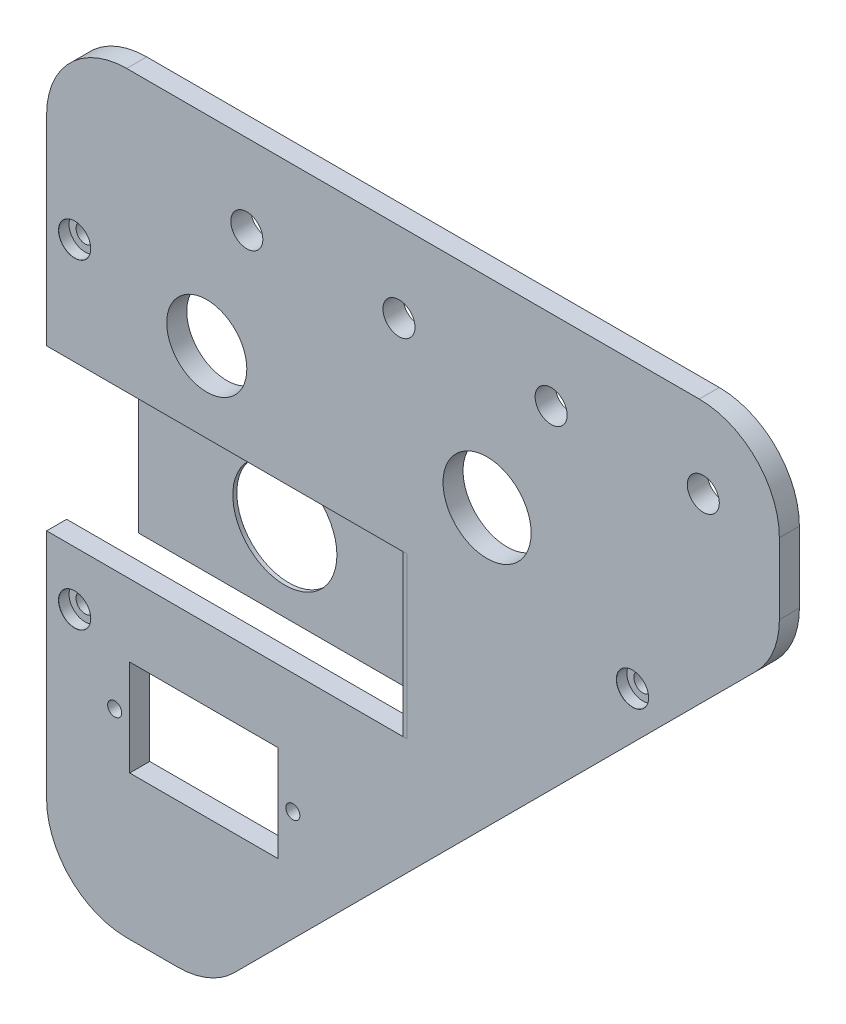
from build123d import *

# Parameters (mm, degrees)
ESTRUSIONE_ESTRUSIONE1_DEPTH                 = 5
FORO_LAMATO_PER_VITE_M4_A_TESTA_CILI_2_COUNT = 2
FORO_LAMATO_PER_VITE_M4_A_TESTA_CILI_2_PITCH = 80
FORO_LAMATO_PER_VITE_M4_A_TESTA_CILI_3_COUNT = 2
FORO_LAMATO_PER_VITE_M4_A_TESTA_CILI_3_PITCH = 141.997761326
TAGLIO_ESTRUSIONE1_DEPTH                     = 263.408079144
TAGLIO_ESTRUSIONE1_DEPTH_BACK                = 263.408079144
SCHIZZO5_R                                   = 1.75
SCHIZZO5_R_2                                 = 10
SCHIZZO5_R_3                                 = 11
SCHIZZO5_R_4                                 = 4
SCHIZZO5_W                                   = 37
SCHIZZO5_H                                   = 24
TAGLIO_ESTRUSIONE2_DEPTH                     = 263.408079144
TAGLIO_ESTRUSIONE2_DEPTH_BACK                = 263.408079144
SCHIZZO7_W                                   = 90
SCHIZZO7_H                                   = 40
FLANGIA_START                                = 78
FLANGIA_CON_SWEEP3_DEPTH                     = 40
TAGLIO_ESTRUSIONE3_DEPTH                     = 263.59093663
TAGLIO_ESTRUSIONE3_DEPTH_BACK                = 263.59093663
SCHIZZO23_R                                  = 13


# Read off the part's stored shape, not the designer's step: Flangia con sweep3
with BuildPart() as part:
    # Schizzo1 → Estrusione-Estrusione1 (new body)
    with BuildSketch(Plane.XY):
        with BuildLine():
            Line((0, 20), (0, 168))
            ThreePointArc((0, 168), (5.857864376, 182.142135624), (20, 188))
            Line((20, 188), (163, 188))
            ThreePointArc((163, 188), (177.142135624, 182.142135624), (183, 168))
            Line((183, 168), (183, 150.284271247))
            ThreePointArc((183, 150.284271247), (181.47759065, 142.6306026), (177.142135624, 136.142135624))
            Line((177.142135624, 136.142135624), (46.857864376, 5.857864376))
            ThreePointArc((46.857864376, 5.857864376), (40.3693974, 1.52240935), (32.715728753, 0))
            Line((32.715728753, 0), (20, 0))
            ThreePointArc((20, 0), (5.857864376, 5.857864376), (0, 20))
        make_face()
    extrude(amount=ESTRUSIONE_ESTRUSIONE1_DEPTH)

    # Schizzo4 → Foro lamato per Vite M4 a testa cilindrica piana-1 (revolve, cut)
    with BuildSketch(Plane(origin=(7, 144.5, 5), x_dir=(0, -1, 0), z_dir=(1, 0, 0))):
        Polygon((0, 0), (0, 5), (2.25, 5), (2.25, 2.6), (4, 2.6), (4, 0.025), (4.025, 0), align=None)
    foro_lamato_per_vite_m4_a_testa_cilindri = revolve(axis=Axis((7, 144.5, 11.35), (0, 0, -1)), mode=Mode.SUBTRACT)

    # Foro lamato per Vite M4 a testa cili 2: Foro lamato per Vite M4 a testa cilindrica piana-1 ×2
    with Locations(*[(0, -i * FORO_LAMATO_PER_VITE_M4_A_TESTA_CILI_2_PITCH, 0) for i in range(1, FORO_LAMATO_PER_VITE_M4_A_TESTA_CILI_2_COUNT)]):
        add(foro_lamato_per_vite_m4_a_testa_cilindri, mode=Mode.SUBTRACT)

    # Foro lamato per Vite M4 a testa cili 3: Foro lamato per Vite M4 a testa cilindrica piana-1 ×2
    with Locations(*[Vector(0.98112021612507, -0.19339886636352308, 0) * (i * FORO_LAMATO_PER_VITE_M4_A_TESTA_CILI_3_PITCH) for i in range(1, FORO_LAMATO_PER_VITE_M4_A_TESTA_CILI_3_COUNT)]):
        add(foro_lamato_per_vite_m4_a_testa_cilindri, mode=Mode.SUBTRACT)

    # Schizzo5 → Taglio-Estrusione1 (cut, two sides: drawn at the far end of the back side and taken through both)
    with BuildSketch(Plane.XY.offset(5).offset(-TAGLIO_ESTRUSIONE1_DEPTH_BACK)):
        with Locations((17, 48)):
            Circle(SCHIZZO5_R)
        with Locations((61.5, 48)):
            Circle(SCHIZZO5_R)
        with Locations((40, 138)):
            Circle(SCHIZZO5_R_2)
        with Locations((110, 138)):
            Circle(SCHIZZO5_R_3)
        with Locations((50, 168)):
            Circle(SCHIZZO5_R_4)
        with Locations((88, 168)):
            Circle(SCHIZZO5_R_4)
        with Locations((126, 168)):
            Circle(SCHIZZO5_R_4)
        with Locations((164, 168)):
            Circle(SCHIZZO5_R_4)
        with Locations((39.25, 48)):
            Rectangle(SCHIZZO5_W, SCHIZZO5_H)
    extrude(amount=TAGLIO_ESTRUSIONE1_DEPTH + TAGLIO_ESTRUSIONE1_DEPTH_BACK, mode=Mode.SUBTRACT)

    # Schizzo7 → Taglio-Estrusione2 (cut, two sides: drawn at the far end of the back side and taken through both)
    with BuildSketch(Plane.XY.offset(5).offset(-TAGLIO_ESTRUSIONE2_DEPTH_BACK)):
        with Locations((45, 98)):
            Rectangle(SCHIZZO7_W, SCHIZZO7_H)
    extrude(amount=TAGLIO_ESTRUSIONE2_DEPTH + TAGLIO_ESTRUSIONE2_DEPTH_BACK, mode=Mode.SUBTRACT)


with BuildPart() as body_2:
    # Flangia con sweep3 outline → Flangia con sweep3 (new body)
    with BuildSketch(Plane(origin=(0, 0, 0), x_dir=(1, 0, 0), z_dir=(0, 1, 0)).offset(FLANGIA_START)):
        with BuildLine():
            Line((85, 7), (12, 7))
            Line((12, 7), (12, 6))
            Line((12, 6), (85, 6))
            ThreePointArc((85, 6), (87.828427125, 4.828427125), (89, 2))
            Line((89, 2), (89, -5))
            Line((89, -5), (90, -5))
            Line((90, -5), (90, 2))
            ThreePointArc((90, 2), (88.535533906, 5.535533906), (85, 7))
        make_face()
    extrude(amount=FLANGIA_CON_SWEEP3_DEPTH)

    # Schizzo23 → Taglio-Estrusione3 (cut, two sides: drawn at the far end of the back side and taken through both)
    with BuildSketch(Plane.XY.offset(-6).offset(-TAGLIO_ESTRUSIONE3_DEPTH_BACK)):
        with Locations((48.5, 98)):
            Circle(SCHIZZO23_R)
    extrude(amount=TAGLIO_ESTRUSIONE3_DEPTH + TAGLIO_ESTRUSIONE3_DEPTH_BACK, mode=Mode.SUBTRACT)


solid = Compound([part.part, body_2.part])
